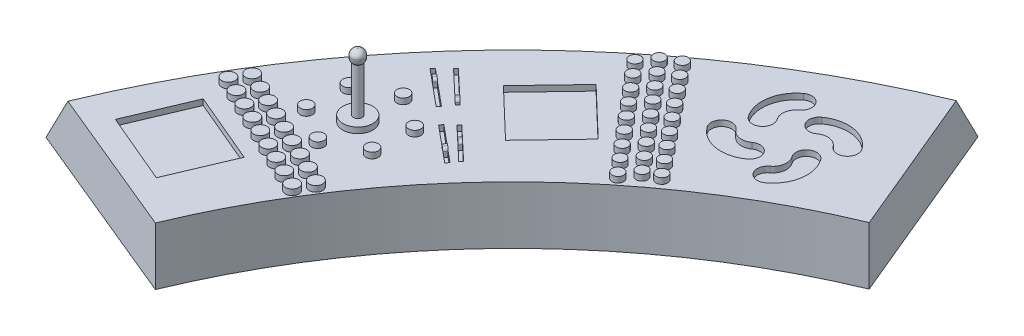
from build123d import *

# Parameters (mm, degrees)
BOSS_EXTRUDE1_DEPTH  = 100
CHAMFER1_SIZE2       = 70.020753821
CHAMFER1_SIZE        = 100
CUT_EXTRUDE1_DEPTH   = 10
SKETCH3_R            = 11.583174485
BOSS_EXTRUDE2_DEPTH  = 10
SKETCH4_R            = 10.725835925
BOSS_EXTRUDE3_DEPTH  = 10
CUT_EXTRUDE2_DEPTH   = 10
CUT_EXTRUDE3_DEPTH   = 10
BOSS_EXTRUDE5_DEPTH  = 14
FILLET2_R            = 5
BOSS_EXTRUDE6_DEPTH  = 14
FILLET3_R            = 5
BOSS_EXTRUDE7_DEPTH  = 14
FILLET4_R            = 5
BOSS_EXTRUDE8_DEPTH  = 14
FILLET5_R            = 5
CUT_EXTRUDE4_DEPTH   = 10
SKETCH12_R           = 10
BOSS_EXTRUDE9_DEPTH  = 10
SKETCH13_R           = 10
BOSS_EXTRUDE10_DEPTH = 10
CUT_EXTRUDE5_DEPTH   = 10
SKETCH16_R           = 25.940039397
BOSS_EXTRUDE11_DEPTH = 10
SKETCH18_R           = 7.830652714
BOSS_EXTRUDE12_DEPTH = 80
SKETCH20_R           = 10.846514213
BOSS_EXTRUDE13_DEPTH = 20
FILLET6_R            = 10
FILLET7_R            = 10


# Some blends are built 0.0001 mm under size
with BuildPart() as part:
    # Sketch1 → Boss-Extrude1 (new body)
    with BuildSketch(Plane(origin=(0, 0, 0), x_dir=(1, 0, 0), z_dir=(0, 1, 0))):
        with BuildLine():
            ThreePointArc((-574.625034982, 1380.741091143), (-1058.683185619, 1056.328454643), (-1382.017174823, 571.549140578))
            Line((-1382.017174823, 571.549140578), (-1058.483825136, 437.74819271))
            ThreePointArc((-1058.483825136, 437.74819271), (-810.843054874, 809.039571751), (-440.10401327, 1057.506475536))
            Line((-440.10401327, 1057.506475536), (-574.625034982, 1380.741091143))
        make_face()
    extrude(amount=BOSS_EXTRUDE1_DEPTH)

    # Chamfer1
    chamfer1_edges = [part.edges().sort_by_distance(p)[0] for p in [
        (-1058.683185619, 100, -1056.328454643),
    ]]
    chamfer1_side = [part.faces().sort_by_distance(p)[0] for p in [
        (-1058.683185619, 98.599584924, -1056.328454643),
    ]]
    chamfer(chamfer1_edges, length=CHAMFER1_SIZE - 0.0001, length2=CHAMFER1_SIZE2 - 0.0001, reference=chamfer1_side[0])  # a hair under: the kernel refuses the full size

    # Sketch2 → Cut-Extrude1 (cut)
    with BuildSketch(Plane(origin=(0, 100, 0), x_dir=(1, 0, 0), z_dir=(0, 1, 0))):
        Polygon((-1248.842324829, 558.677183014), (-1125.639904434, 506.53868455), (-1080.337404293, 613.587752545), (-1203.539824688, 665.72625101), align=None)
    extrude(amount=-CUT_EXTRUDE1_DEPTH, mode=Mode.SUBTRACT)

    # Sketch3 → Boss-Extrude2 (add)
    with BuildSketch(Plane(origin=(0, 100, 0), x_dir=(1, 0, 0), z_dir=(0, 1, 0))):
        with Locations(Location((-1204.814109659, 710.81545594, 0), (0, 0, 270))):
            Circle(SKETCH3_R)
        with Locations(Location((-1177.85028827, 697.664321536, 0), (0, 0, 270))):
            Circle(SKETCH3_R)
        with Locations(Location((-1150.886466881, 684.513187133, 0), (0, 0, 270))):
            Circle(SKETCH3_R)
        with Locations(Location((-1123.922645492, 671.362052729, 0), (0, 0, 270))):
            Circle(SKETCH3_R)
        with Locations(Location((-1096.958824103, 658.210918325, 0), (0, 0, 270))):
            Circle(SKETCH3_R)
        with Locations(Location((-1069.995002714, 645.059783922, 0), (0, 0, 270))):
            Circle(SKETCH3_R)
        with Locations(Location((-1043.031181325, 631.908649518, 0), (0, 0, 270))):
            Circle(SKETCH3_R)
        with Locations(Location((-1016.067359936, 618.757515114, 0), (0, 0, 270))):
            Circle(SKETCH3_R)
        with Locations(Location((-989.103538547, 605.606380711, 0), (0, 0, 270))):
            Circle(SKETCH3_R)
        with Locations(Location((-1162.399146022, 723.379340558, 0), (0, 0, 270))):
            Circle(SKETCH3_R)
        with Locations(Location((-1135.435324633, 710.228206154, 0), (0, 0, 270))):
            Circle(SKETCH3_R)
        with Locations(Location((-1108.471503244, 697.07707175, 0), (0, 0, 270))):
            Circle(SKETCH3_R)
        with Locations(Location((-1081.507681855, 683.925937347, 0), (0, 0, 270))):
            Circle(SKETCH3_R)
        with Locations(Location((-1054.543860466, 670.774802943, 0), (0, 0, 270))):
            Circle(SKETCH3_R)
        with Locations(Location((-1027.580039077, 657.623668539, 0), (0, 0, 270))):
            Circle(SKETCH3_R)
        with Locations(Location((-1000.616217688, 644.472534136, 0), (0, 0, 270))):
            Circle(SKETCH3_R)
        with Locations(Location((-973.652396299, 631.321399732, 0), (0, 0, 270))):
            Circle(SKETCH3_R)
        with Locations(Location((-1189.362967411, 736.530474961, 0), (0, 0, 270))):
            Circle(SKETCH3_R)
    extrude(amount=BOSS_EXTRUDE2_DEPTH)

    # Sketch4 → Boss-Extrude3 (add)
    with BuildSketch(Plane(origin=(0, 100, 0), x_dir=(1, 0, 0), z_dir=(0, 1, 0))):
        with Locations(Location((-1091.388943428, 806.40600459, 0), (0, 0, 270))):
            Circle(SKETCH4_R)
        with Locations(Location((-1028.858083789, 837.868547283, 0), (0, 0, 270))):
            Circle(SKETCH4_R)
        with Locations(Location((-970.345292729, 799.446505661, 0), (0, 0, 270))):
            Circle(SKETCH4_R)
        with Locations(Location((-974.363361309, 729.561921346, 0), (0, 0, 270))):
            Circle(SKETCH4_R)
        with Locations(Location((-1036.894220949, 698.099378653, 0), (0, 0, 270))):
            Circle(SKETCH4_R)
        with Locations(Location((-1095.407012008, 736.521420275, 0), (0, 0, 270))):
            Circle(SKETCH4_R)
    extrude(amount=BOSS_EXTRUDE3_DEPTH)

    # Sketch5 → Cut-Extrude2 (cut)
    with BuildSketch(Plane(origin=(0, 100, 0), x_dir=(1, 0, 0), z_dir=(0, 1, 0))):
        Polygon((-1052.159927022, 907.83256467), (-989.74452497, 856.022208277), (-985.570980936, 861.050033734), (-1047.986382988, 912.860390128), align=None)
        Polygon((-960.234593848, 830.698051508), (-897.819191795, 778.887695114), (-893.645647762, 783.915520572), (-956.061049814, 835.725876966), align=None)
    extrude(amount=-CUT_EXTRUDE2_DEPTH, mode=Mode.SUBTRACT)

    # Sketch6 → Cut-Extrude3 (cut)
    with BuildSketch(Plane(origin=(0, 100, 0), x_dir=(1, 0, 0), z_dir=(0, 1, 0))):
        Polygon((-1032.013602864, 928.403195835), (-975.414588709, 874.930713303), (-971.326102013, 879.258253477), (-1027.925116168, 932.73073601), align=None)
        Polygon((-944.25115867, 846.563392628), (-887.652144515, 793.090910095), (-883.563657818, 797.41845027), (-940.162671974, 850.890932802), align=None)
    extrude(amount=-CUT_EXTRUDE3_DEPTH, mode=Mode.SUBTRACT)

    # Sketch7 → Boss-Extrude5 (add)
    with BuildSketch(Plane(origin=(0, 90, 0), x_dir=(1, 0, 0), z_dir=(0, 1, 0))):
        Polygon((-1038.277153402, 897.00305942), (-1034.444892806, 901.61974424), (-1026.891307479, 895.349594005), (-1030.723568075, 890.732909185), align=None)
    extrude(amount=BOSS_EXTRUDE5_DEPTH)

    # Fillet2
    # the kernel refuses this fillet: 5 mm, written as the material it takes off along each edge
    with BuildSketch(Plane(origin=(-1026.891307479, 104, -895.349594005), x_dir=(0, -1, 0), z_dir=(-0.6387100993289168, 0, 0.7694474699518125))) as fillet2_piece_1:
        with BuildLine():
            CenterArc((FILLET2_R, -FILLET2_R), FILLET2_R, 90, 90)
            Line((0, -FILLET2_R), (0, 0))
            Line((0, 0), (FILLET2_R, 0))
        make_face()
    extrude(amount=6, mode=Mode.SUBTRACT)

    # Sketch8 → Boss-Extrude6 (add)
    with BuildSketch(Plane(origin=(0, 90, 0), x_dir=(1, 0, 0), z_dir=(0, 1, 0))):
        Polygon((-920.547101963, 806.246129425), (-924.853348788, 801.058438283), (-917.550465411, 794.99639305), (-913.244218585, 800.184084192), align=None)
    extrude(amount=BOSS_EXTRUDE6_DEPTH)

    # Fillet3
    # the kernel refuses this fillet: 5 mm, written as the material it takes off along each edge
    with BuildSketch(Plane(origin=(-925.534341652, 104, -785.378299676), x_dir=(0, -1, 0), z_dir=(0.6387100993288941, 0, -0.7694474699518312))) as fillet3_piece_1_section:
        with BuildLine():
            CenterArc((FILLET3_R, FILLET3_R), FILLET3_R, 180, 90)
            Line((0, FILLET3_R), (0, 0))
            Line((0, 0), (FILLET3_R, 0))
        make_face()
    fillet3_piece_1 = extrude(amount=19.242099162, mode=Mode.PRIVATE)
    fillet3_piece_1 = split(fillet3_piece_1, bisect_by=Plane(origin=(-922.36617403, 100, -791.006159851), z_dir=(0, 1, 0)), keep=Keep.TOP, mode=Mode.PRIVATE)
    fillet3_piece_1 = split(fillet3_piece_1, bisect_by=Plane(origin=(-918.307884513, 102.938736848, -795.895139381), z_dir=(-0.6387100993289097, 0, 0.7694474699518183)), keep=Keep.TOP, mode=Mode.PRIVATE)
    add(fillet3_piece_1, mode=Mode.SUBTRACT)
    with BuildSketch(Plane(origin=(-925.534341652, 104, -785.378299676), x_dir=(0, -1, 0), z_dir=(0.6387100993288941, 0, -0.7694474699518312))) as fillet3_piece_2_section:
        with BuildLine():
            CenterArc((FILLET3_R, FILLET3_R), FILLET3_R, 180, 90)
            Line((0, FILLET3_R), (0, 0))
            Line((0, 0), (FILLET3_R, 0))
        make_face()
    fillet3_piece_2 = extrude(amount=19.242099162, mode=Mode.PRIVATE)
    fillet3_piece_2 = split(fillet3_piece_2, bisect_by=Plane(origin=(-915.308026208, 100, -797.651108966), z_dir=(0, -1, 0)), keep=Keep.TOP, mode=Mode.PRIVATE)
    fillet3_piece_2 = split(fillet3_piece_2, bisect_by=Plane(origin=(-917.394798225, 99.562912463, -795.137196237), z_dir=(0.6387100993289097, 0, -0.7694474699518183)), keep=Keep.TOP, mode=Mode.PRIVATE)
    add(fillet3_piece_2, mode=Mode.SUBTRACT)
    with BuildSketch(Plane(origin=(-925.534341652, 104, -785.378299676), x_dir=(0, -1, 0), z_dir=(0.6387100993288941, 0, -0.7694474699518312))) as fillet3_piece_3_section:
        with BuildLine():
            CenterArc((FILLET3_R, FILLET3_R), FILLET3_R, 180, 90)
            Line((0, FILLET3_R), (0, 0))
            Line((0, 0), (FILLET3_R, 0))
        make_face()
    fillet3_piece_3 = extrude(amount=19.242099162, mode=Mode.PRIVATE)
    fillet3_piece_3 = split(fillet3_piece_3, bisect_by=Plane(origin=(-916.221112497, 100, -798.409052109), z_dir=(0, 1, 0)), keep=Keep.TOP, mode=Mode.PRIVATE)
    fillet3_piece_3 = split(fillet3_piece_3, bisect_by=Plane(origin=(-918.307884513, 102.938736848, -795.895139381), z_dir=(0.6387100993289097, 0, -0.7694474699518183)), keep=Keep.TOP, mode=Mode.PRIVATE)
    add(fillet3_piece_3, mode=Mode.SUBTRACT)
    with BuildSketch(Plane(origin=(-925.534341652, 104, -785.378299676), x_dir=(0, -1, 0), z_dir=(0.6387100993288941, 0, -0.7694474699518312))) as fillet3_piece_4_section:
        with BuildLine():
            CenterArc((FILLET3_R, FILLET3_R), FILLET3_R, 180, 90)
            Line((0, FILLET3_R), (0, 0))
            Line((0, 0), (FILLET3_R, 0))
        make_face()
    fillet3_piece_4 = extrude(amount=31.742099162, mode=Mode.PRIVATE)
    fillet3_piece_4 = split(fillet3_piece_4, bisect_by=Plane(origin=(-910.142402359, 100, -805.732011525), z_dir=(0, 1, 0)), keep=Keep.TOP, mode=Mode.PRIVATE)
    fillet3_piece_4 = split(fillet3_piece_4, bisect_by=Plane(origin=(-914.13434048, 102.938736848, -800.922964838), z_dir=(0.6387100993289105, 0, -0.7694474699518177)), keep=Keep.TOP, mode=Mode.PRIVATE)
    add(fillet3_piece_4, mode=Mode.SUBTRACT)

    # Sketch9 → Boss-Extrude7 (add)
    with BuildSketch(Plane(origin=(0, 90, 0), x_dir=(1, 0, 0), z_dir=(0, 1, 0))):
        Polygon((-917.423250197, 829.407637521), (-921.511736893, 825.080097346), (-914.635100744, 818.58332683), (-910.546614048, 822.910867005), align=None)
    extrude(amount=BOSS_EXTRUDE7_DEPTH)

    # Fillet4
    # the kernel refuses this fillet: 5 mm, written as the material it takes off along each edge
    with BuildSketch(Plane(origin=(-914.635100744, 104, -818.58332683), x_dir=(0, -1, 0), z_dir=(0.6867447460277213, 0, -0.7268986544239305))) as fillet4_piece_1:
        with BuildLine():
            CenterArc((FILLET4_R, FILLET4_R), FILLET4_R, 180, 90)
            Line((0, FILLET4_R), (0, 0))
            Line((0, 0), (FILLET4_R, 0))
        make_face()
    extrude(amount=5.953429888, mode=Mode.SUBTRACT)

    # Sketch10 → Boss-Extrude8 (add)
    with BuildSketch(Plane(origin=(0, 90, 0), x_dir=(1, 0, 0), z_dir=(0, 1, 0))):
        Polygon((-982.995580419, 890.283109468), (-987.084067115, 885.955569293), (-980.342960021, 879.586841203), (-976.254473325, 883.914381377), align=None)
    extrude(amount=BOSS_EXTRUDE8_DEPTH)

    # Fillet5
    # the kernel refuses this fillet: 5 mm, written as the material it takes off along each edge
    with BuildSketch(Plane(origin=(-980.342960021, 104, -879.586841203), x_dir=(0, -1, 0), z_dir=(0.6867447460277016, 0, -0.726898654423949))) as fillet5_piece_1:
        with BuildLine():
            CenterArc((FILLET5_R, FILLET5_R), FILLET5_R, 180, 90)
            Line((0, FILLET5_R), (0, 0))
            Line((0, 0), (FILLET5_R, 0))
        make_face()
    extrude(amount=5.953429888, mode=Mode.SUBTRACT)

    # Sketch11 → Cut-Extrude4 (cut)
    with BuildSketch(Plane(origin=(0, 100, 0), x_dir=(1, 0, 0), z_dir=(0, 1, 0))):
        Polygon((-962.972687432, 945.883255461), (-879.042012609, 865.640683516), (-800.470627892, 947.823360132), (-884.401302715, 1028.065932078), align=None)
    extrude(amount=-CUT_EXTRUDE4_DEPTH, mode=Mode.SUBTRACT)

    # Sketch12 → Boss-Extrude9 (add)
    with BuildSketch(Plane(origin=(0, 100, 0), x_dir=(1, 0, 0), z_dir=(0, 1, 0))):
        with Locations(Location((-878.592594344, 1089.618940854, 0), (0, 0, 270))):
            Circle(SKETCH12_R)
        with Locations(Location((-859.308966054, 1066.637607561, 0), (0, 0, 270))):
            Circle(SKETCH12_R)
        with Locations(Location((-840.025337763, 1043.656274267, 0), (0, 0, 270))):
            Circle(SKETCH12_R)
        with Locations(Location((-820.741709473, 1020.674940974, 0), (0, 0, 270))):
            Circle(SKETCH12_R)
        with Locations(Location((-801.458081182, 997.69360768, 0), (0, 0, 270))):
            Circle(SKETCH12_R)
        with Locations(Location((-782.174452891, 974.712274387, 0), (0, 0, 270))):
            Circle(SKETCH12_R)
        with Locations(Location((-762.890824601, 951.730941093, 0), (0, 0, 270))):
            Circle(SKETCH12_R)
        with Locations(Location((-743.60719631, 928.749607799, 0), (0, 0, 270))):
            Circle(SKETCH12_R)
        with Locations(Location((-724.32356802, 905.768274506, 0), (0, 0, 270))):
            Circle(SKETCH12_R)
        with Locations(Location((-841.254515359, 1090.596672862, 0), (0, 0, 270))):
            Circle(SKETCH12_R)
        with Locations(Location((-821.970887069, 1067.615339569, 0), (0, 0, 270))):
            Circle(SKETCH12_R)
        with Locations(Location((-802.687258778, 1044.634006275, 0), (0, 0, 270))):
            Circle(SKETCH12_R)
        with Locations(Location((-783.403630487, 1021.652672982, 0), (0, 0, 270))):
            Circle(SKETCH12_R)
        with Locations(Location((-764.120002197, 998.671339688, 0), (0, 0, 270))):
            Circle(SKETCH12_R)
        with Locations(Location((-744.836373906, 975.690006394, 0), (0, 0, 270))):
            Circle(SKETCH12_R)
        with Locations(Location((-725.552745616, 952.708673101, 0), (0, 0, 270))):
            Circle(SKETCH12_R)
        with Locations(Location((-706.269117325, 929.727339807, 0), (0, 0, 270))):
            Circle(SKETCH12_R)
        with Locations(Location((-860.53814365, 1113.578006156, 0), (0, 0, 270))):
            Circle(SKETCH12_R)
    extrude(amount=BOSS_EXTRUDE9_DEPTH)

    # Sketch13 → Boss-Extrude10 (add)
    with BuildSketch(Plane(origin=(0, 100, 0), x_dir=(1, 0, 0), z_dir=(0, 1, 0))):
        with Locations(Location((-835.281461965, 1128.557237822, 0), (0, 0, 270))):
            Circle(SKETCH13_R)
        with Locations(Location((-816.401850234, 1105.242858978, 0), (0, 0, 270))):
            Circle(SKETCH13_R)
        with Locations(Location((-797.522238502, 1081.928480134, 0), (0, 0, 270))):
            Circle(SKETCH13_R)
        with Locations(Location((-778.642626771, 1058.614101291, 0), (0, 0, 270))):
            Circle(SKETCH13_R)
        with Locations(Location((-759.763015039, 1035.299722447, 0), (0, 0, 270))):
            Circle(SKETCH13_R)
        with Locations(Location((-740.883403308, 1011.985343603, 0), (0, 0, 270))):
            Circle(SKETCH13_R)
        with Locations(Location((-722.003791576, 988.670964759, 0), (0, 0, 270))):
            Circle(SKETCH13_R)
        with Locations(Location((-703.124179845, 965.356585916, 0), (0, 0, 270))):
            Circle(SKETCH13_R)
        with Locations(Location((-684.244568113, 942.042207072, 0), (0, 0, 270))):
            Circle(SKETCH13_R)
    extrude(amount=BOSS_EXTRUDE10_DEPTH)

    # Sketch15 → Cut-Extrude5 (cut)
    with BuildSketch(Plane(origin=(0, 100, 0), x_dir=(1, 0, 0), z_dir=(0, 1, 0))):
        with BuildLine():
            ThreePointArc((-690.822105388, 1194.662465882), (-714.571817853, 1155.857743903), (-703.926318535, 1111.625079114))
            ThreePointArc((-703.926318535, 1111.625079114), (-678.941034691, 1107.682126454), (-674.998082031, 1132.667410298))
            ThreePointArc((-674.998082031, 1132.667410298), (-679.237290582, 1150.281566776), (-669.779774204, 1165.734229379))
            ThreePointArc((-669.779774204, 1165.734229379), (-665.836821544, 1190.719513222), (-690.822105388, 1194.662465882))
        make_face()
        with BuildLine():
            ThreePointArc((-556.575048678, 1161.361976028), (-595.379770657, 1185.111688493), (-639.612435446, 1174.466189175))
            ThreePointArc((-639.612435446, 1174.466189175), (-643.555388106, 1149.480905331), (-618.570104262, 1145.537952671))
            ThreePointArc((-618.570104262, 1145.537952671), (-600.955947784, 1149.777161222), (-585.503285181, 1140.319644844))
            ThreePointArc((-585.503285181, 1140.319644844), (-560.518001338, 1136.376692184), (-556.575048678, 1161.361976028))
        make_face()
        with BuildLine():
            ThreePointArc((-589.875538532, 1027.114919318), (-566.125826067, 1065.919641297), (-576.771325385, 1110.152306086))
            ThreePointArc((-576.771325385, 1110.152306086), (-601.756609229, 1114.095258746), (-605.699561889, 1089.109974902))
            ThreePointArc((-605.699561889, 1089.109974902), (-601.460353338, 1071.495818425), (-610.917869716, 1056.043155822))
            ThreePointArc((-610.917869716, 1056.043155822), (-614.860822376, 1031.057871978), (-589.875538532, 1027.114919318))
        make_face()
        with BuildLine():
            ThreePointArc((-724.122595242, 1060.415409173), (-685.317873263, 1036.665696707), (-641.085208474, 1047.311196025))
            ThreePointArc((-641.085208474, 1047.311196025), (-637.142255814, 1072.296479869), (-662.127539658, 1076.239432529))
            ThreePointArc((-662.127539658, 1076.239432529), (-679.741696136, 1072.000223979), (-695.194358739, 1081.457740356))
            ThreePointArc((-695.194358739, 1081.457740356), (-720.179642582, 1085.400693016), (-724.122595242, 1060.415409173))
        make_face()
    extrude(amount=-CUT_EXTRUDE5_DEPTH, mode=Mode.SUBTRACT)

    # Sketch16 → Boss-Extrude11 (add)
    with BuildSketch(Plane(origin=(0, 100, 0), x_dir=(1, 0, 0), z_dir=(0, 1, 0))):
        with Locations(Location((-1035.334103084, 765.725261814, 0), (0, 0, 270))):
            Circle(SKETCH16_R)
    extrude(amount=BOSS_EXTRUDE11_DEPTH)

    # Sketch18 → Boss-Extrude12 (add)
    with BuildSketch(Plane(origin=(0, 110, 0), x_dir=(1, 0, 0), z_dir=(0, 1, 0))):
        with Locations(Location((-1035.334103084, 765.725261814, 0), (0, 0, 270))):
            Circle(SKETCH18_R)
    extrude(amount=BOSS_EXTRUDE12_DEPTH)

    # Sketch20 → Boss-Extrude13 (add)
    with BuildSketch(Plane(origin=(0, 190, 0), x_dir=(1, 0, 0), z_dir=(0, 1, 0))):
        with Locations(Location((-1035.334103084, 765.725261814, 0), (0, 0, 270))):
            Circle(SKETCH20_R)
    extrude(amount=BOSS_EXTRUDE13_DEPTH)

    # Fillet6
    fillet6_edges = [part.edges().sort_by_distance(p)[0] for p in [
        (-1035.334103084, 210, -776.571776027),
    ]]
    fillet(fillet6_edges, radius=FILLET6_R)

    # Fillet7
    # the kernel refuses this fillet: 10 mm, written as the material it takes off along each edge
    with BuildSketch(Plane(origin=(-1035.334103084, 190, -765.725261814), x_dir=(0, 0, 1), z_dir=(-1, 0, 0))) as fillet7_piece_1:
        with BuildLine():
            CenterArc((0.846514213, 7.156941343), FILLET7_R, 314.299885096, 45.700114904)
            Line((7.830652714, 0), (7.970335484, -0.143138827))
            ThreePointArc((7.970335484, -0.143138827), (9.338583463, -0.2), (10.846514213, -0.2))
            Line((10.846514213, -0.2), (11.046514213, 0))
            Line((11.046514213, 0), (11.046514213, 7.156941343))
            Line((11.046514213, 7.156941343), (10.846514213, 7.156941343))
        make_face()
    revolve(axis=Axis((-1035.334103084, 190, -765.725261814), (0, 1, 0)), mode=Mode.SUBTRACT)


solid = part.part
